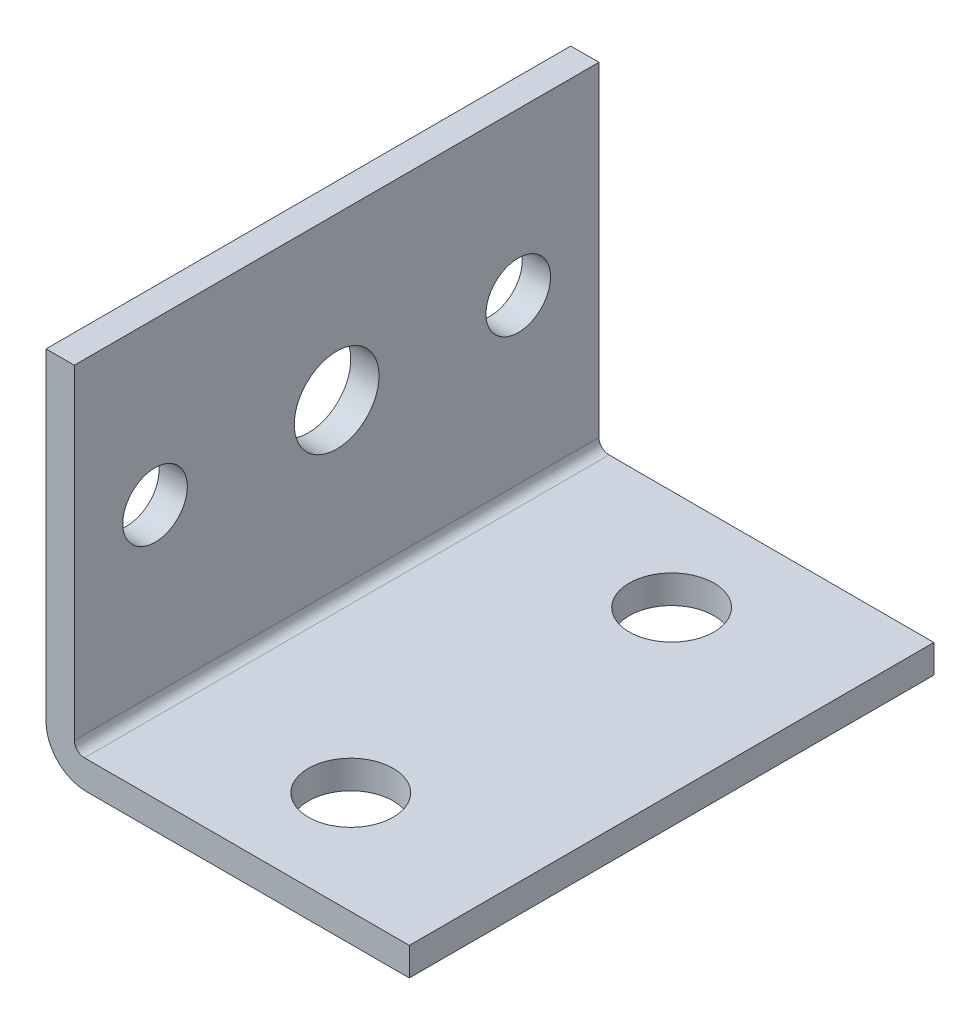
from build123d import *

# Parameters (mm, degrees)
BOSS_EXTRUDE1_DEPTH = 66.04
FILLET1_R           = 1.27
FILLET3_R           = 5.08
SKETCH2_R           = 5.334
SKETCH2_R_2         = 4.064
CUT_EXTRUDE1_DEPTH  = 66.04
SKETCH3_R           = 5.334
CUT_EXTRUDE2_DEPTH  = 66.04


with BuildPart() as part:
    # Sketch1 → Boss-Extrude1 (new body)
    with BuildSketch(Plane.XY):
        Polygon((-17.078190635, 26.453063941), (-20.634190635, 26.453063941), (-20.634190635, -19.266936059), (25.085809365, -19.266936059), (25.085809365, -15.710936059), (-17.078190635, -15.710936059), align=None)
    extrude(amount=-BOSS_EXTRUDE1_DEPTH)

    # Fillet1
    fillet1_edges = [part.edges().sort_by_distance(p)[0] for p in [
        (-17.078190635, -15.710936059, -33.02),
    ]]
    fillet(fillet1_edges, radius=FILLET1_R)

    # Fillet3
    fillet3_edges = [part.edges().sort_by_distance(p)[0] for p in [
        (-20.634190635, -19.266936059, -33.02),
    ]]
    fillet(fillet3_edges, radius=FILLET3_R)

    # Sketch2 → Cut-Extrude1 (cut)
    with BuildSketch(Plane.ZY.offset(20.634190635)):
        with Locations((-33.02, 6.133063941)):
            Circle(SKETCH2_R)
        with Locations((-55.88, 6.133063941)):
            Circle(SKETCH2_R_2)
        with Locations((-10.16, 6.133063941)):
            Circle(SKETCH2_R_2)
    extrude(amount=-CUT_EXTRUDE1_DEPTH, mode=Mode.SUBTRACT)

    # Sketch3 → Cut-Extrude2 (cut)
    with BuildSketch(Plane(origin=(0, -19.266936059, 0), x_dir=(-1, 0, 0), z_dir=(0, -1, 0))):
        with Locations((-4.765809365, 12.954)):
            Circle(SKETCH3_R)
        with Locations((-4.765809365, 53.34)):
            Circle(SKETCH3_R)
    extrude(amount=-CUT_EXTRUDE2_DEPTH, mode=Mode.SUBTRACT)


solid = part.part
